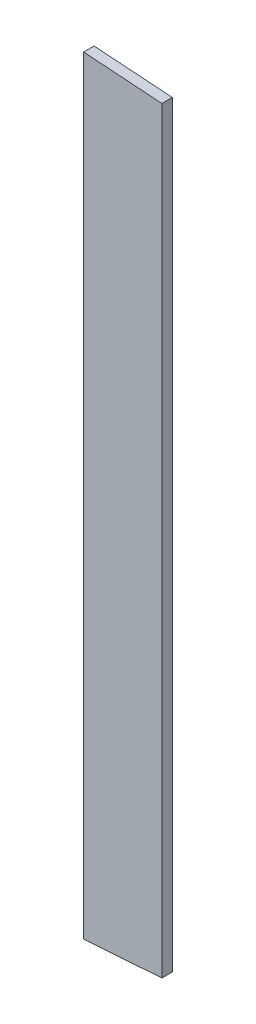
from build123d import *

# Parameters (mm, degrees)
BOSS_EXTRUDE1_DEPTH = 2


with BuildPart() as part:
    # Sketch1 → Boss-Extrude1 (new body)
    with BuildSketch(Plane.XY.offset(3095.349999999)):
        Polygon((-49.769678516, 346.108282384), (-64.769678516, 345.059380205), (-64.769678516, 492.415801833), (-49.769678516, 491.366899654), align=None)
    extrude(amount=BOSS_EXTRUDE1_DEPTH)


solid = part.part
